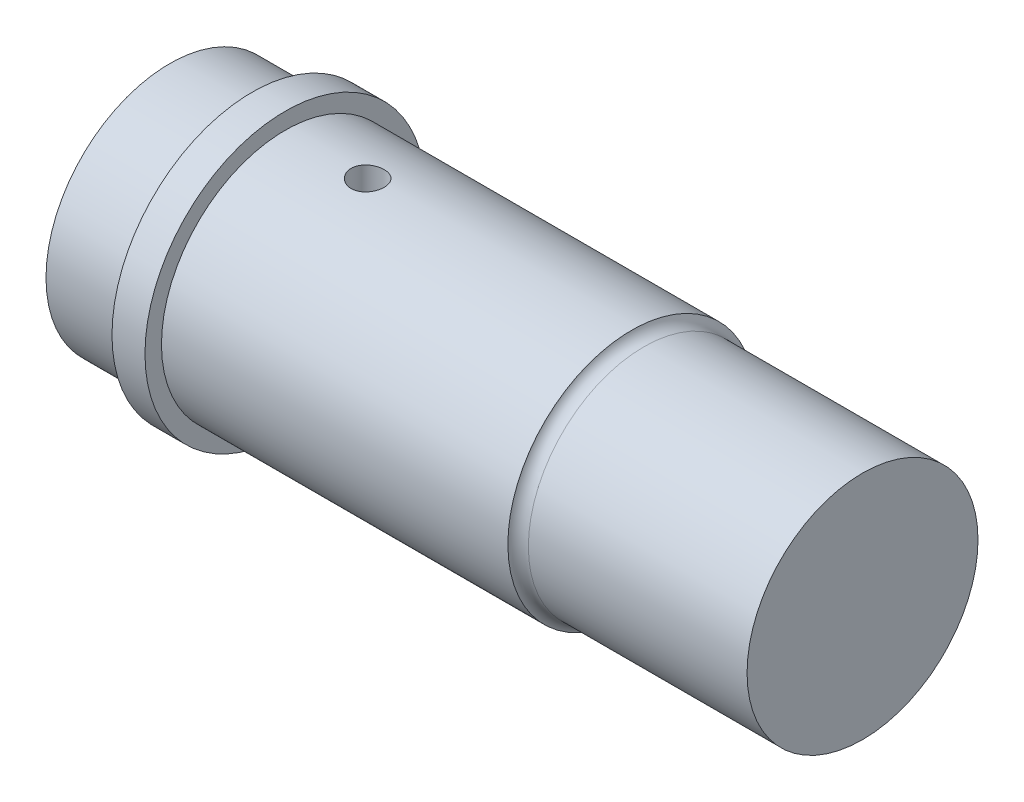
from build123d import *

# Parameters (mm, degrees)
SKETCH1_R           = 7.5
BOSS_EXTRUDE1_DEPTH = 5
SKETCH2_R           = 8.5
BOSS_EXTRUDE2_DEPTH = 2
SKETCH3_R           = 7.5
BOSS_EXTRUDE3_DEPTH = 35
SKETCH4_R           = 4
CUT_EXTRUDE1_DEPTH  = 20.5
SKETCH6_W           = 3
SKETCH6_H           = 1.5
CUT_EXTRUDE2_DEPTH  = 20.5
CUT_EXTRUDE3_REACH  = 47.741
SKETCH7_R           = 1
CUT_EXTRUDE5_START  = -35
SKETCH8_W           = 5
SKETCH8_H           = 4
CUT_EXTRUDE5_DEPTH  = 19
CUT_EXTRUDE6_START  = -14
SKETCH9_R           = 7.5
SKETCH9_R_2         = 7
CUT_EXTRUDE6_DEPTH  = 14
FILLET1_R           = 0.8


with BuildPart() as part:
    # Sketch1 → Boss-Extrude1 (new body)
    with BuildSketch(Plane(origin=(0, 0, 0), x_dir=(0, 0, -1), z_dir=(1, 0, 0))):
        Circle(SKETCH1_R)
    extrude(amount=BOSS_EXTRUDE1_DEPTH)

    # Sketch2 → Boss-Extrude2 (add)
    with BuildSketch(Plane(origin=(5, 0, 0), x_dir=(0, 0, -1), z_dir=(1, 0, 0))):
        Circle(SKETCH2_R)
    extrude(amount=BOSS_EXTRUDE2_DEPTH)

    # Sketch3 → Boss-Extrude3 (add)
    with BuildSketch(Plane(origin=(7, 0, 0), x_dir=(0, 0, -1), z_dir=(1, 0, 0))):
        Circle(SKETCH3_R)
    extrude(amount=BOSS_EXTRUDE3_DEPTH)

    # Sketch4 → Cut-Extrude1 (cut)
    with BuildSketch(Plane.ZY):
        Circle(SKETCH4_R)
    extrude(amount=-CUT_EXTRUDE1_DEPTH, mode=Mode.SUBTRACT)

    # Sketch6 → Cut-Extrude2 (cut)
    with BuildSketch(Plane.ZY):
        with Locations((0, 4)):
            Rectangle(SKETCH6_W, SKETCH6_H)
    extrude(amount=-CUT_EXTRUDE2_DEPTH, mode=Mode.SUBTRACT)

    # Sketch7 → Cut-Extrude3 (cut, up to next)
    with BuildSketch(Plane(origin=(0, 7.5, 0), x_dir=(1, 0, 0), z_dir=(0, 1, 0)), mode=Mode.PRIVATE) as cut_extrude3_sk1:
        with Locations(Location((12, 0, 0), (0, 0, 270))):
            Circle(SKETCH7_R)
    cut_extrude3_tool1 = extrude(cut_extrude3_sk1.sketch, amount=-CUT_EXTRUDE3_REACH, mode=Mode.PRIVATE) & part.part
    add(cut_extrude3_tool1.solids().sort_by_distance((12, 7.5, 0))[0], mode=Mode.SUBTRACT)

    # Sketch8 → Cut-Extrude5 (cut)
    with BuildSketch(Plane(origin=(42, 0, 0), x_dir=(0, 0, -1), z_dir=(1, 0, 0)).offset(CUT_EXTRUDE5_START)):
        with Locations((0, -7.5)):
            Rectangle(SKETCH8_W, SKETCH8_H)
    extrude(amount=CUT_EXTRUDE5_DEPTH, mode=Mode.SUBTRACT)

    # Sketch9 → Cut-Extrude6 (cut)
    with BuildSketch(Plane(origin=(42, 0, 0), x_dir=(0, 0, -1), z_dir=(1, 0, 0)).offset(CUT_EXTRUDE6_START)):
        with Locations(Location((0, 0, 0), (0, 0, 250.528779366))):
            Circle(SKETCH9_R)
        Circle(SKETCH9_R_2, mode=Mode.SUBTRACT)
    extrude(amount=CUT_EXTRUDE6_DEPTH, mode=Mode.SUBTRACT)

    # Fillet1
    # the kernel refuses this fillet: 0.8 mm, written as the material it adds along each edge
    with BuildSketch(Plane(origin=(28, 0, 0), x_dir=(0, 0, -1), z_dir=(0, -1, 0))) as fillet1_piece_1:
        with BuildLine():
            CenterArc((7.8, 0.741619849), FILLET1_R, 180, 67.975687163)
            Line((7, 0.741619849), (6.984, 0.741619849))
            Line((6.984, 0.741619849), (6.984, 0))
            Line((6.984, 0), (7, -0.016))
            ThreePointArc((7, -0.016), (7.25, -0.016), (7.494, -0.014832397))
            Line((7.494, -0.014832397), (7.5, 0))
        make_face()
    revolve(axis=Axis((28, 0, 0), (1, 0, 0)))


solid = part.part
